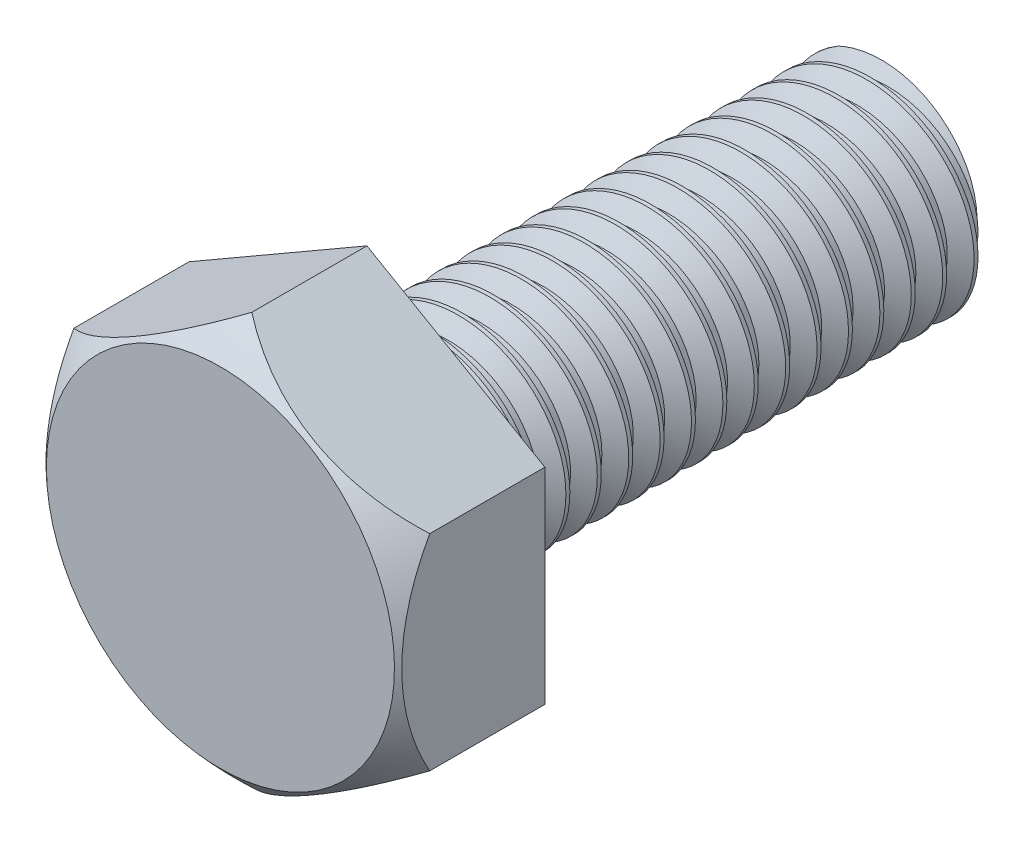
from build123d import *

# Parameters (mm, degrees)
SKETCH1_R           = 5
BOSS_EXTRUDE1_DEPTH = 25
BOSS_EXTRUDE2_DEPTH = 7
THREAD1_PITCH       = 1.5


with BuildPart() as part:
    # Sketch1 → Boss-Extrude1 (new body)
    with BuildSketch(Plane.XY):
        Circle(SKETCH1_R)
    extrude(amount=BOSS_EXTRUDE1_DEPTH)

    # Sketch2 → Boss-Extrude2 (add)
    with BuildSketch(Plane.XY.offset(25)):
        Polygon((0, -9.814954576), (8.5, -4.907477288), (8.5, 4.907477288), (0, 9.814954576), (-8.5, 4.907477288), (-8.5, -4.907477288), align=None)
    extrude(amount=BOSS_EXTRUDE2_DEPTH)

    # Sketch3 → Cut-Revolve1 (revolve, cut)
    with BuildSketch(Plane(origin=(0, 0, 0), x_dir=(0, 0, -1), z_dir=(1, 0, 0)), mode=Mode.PRIVATE) as cut_revolve1_sk:
        with BuildLine():
            Line((-30.5, 9.814954576), (-32, 9.814954576))
            Line((-32, 9.814954576), (-32, 8.314954576))
            ThreePointArc((-32, 8.314954576), (-31.272116302, 9.087070878), (-30.5, 9.814954576))
        make_face()
    revolve(cut_revolve1_sk.sketch.rotate(Axis((0, 0, 32), (0, 0, 1)), 240.000013872), axis=Axis((0, 0, 32), (0, 0, 1)), mode=Mode.SUBTRACT)

    # Thread1: the profile of Thread Profile1 profile screwed along a right-hand helix of 16.666667 turns, 8 arcs to a turn; built about Z, then put on its axis
    thread1_z = Axis((0, 0, 0), (0, 0, 1))
    thread1_corners = [(5.0003, 0, -0.000173205), (5.0003, 0, 1.312673201), (4.188101187, 0, 0.843749998), (4.188101187, 0, 0.468749998)]
    with BuildLine(mode=Mode.PRIVATE) as thread1_profile:
        Line(thread1_corners[0], thread1_corners[1])
        Line(thread1_corners[1], thread1_corners[2])
        Line(thread1_corners[2], thread1_corners[3])
        Line(thread1_corners[3], thread1_corners[0])
    thread1_cap = Face(thread1_profile.wire())
    thread1_turn_angles = [0, 22.5, 45, 67.5, 90, 112.5, 135, 157.5, 180, 202.5, 225, 247.5, 270, 292.5, 315, 337.5, 360]
    thread1_turn_weights = [1, 0.9238795325112867, 1, 0.9238795325112867, 1, 0.9238795325112867, 1, 0.9238795325112867, 1, 0.9238795325112867, 1, 0.9238795325112867, 1, 0.9238795325112867, 1, 0.9238795325112867, 1]
    thread1_turn_rails = [Edge.make_bspline([Vector(p[0], p[1], 0).rotate(thread1_z, thread1_turn_angles[k]) / thread1_turn_weights[k] + Vector(0, 0, p[2] + THREAD1_PITCH * thread1_turn_angles[k] / 360) for k in range(17)], [0, 0, 0, 1, 1, 2, 2, 3, 3, 4, 4, 5, 5, 6, 6, 7, 7, 8, 8, 8], 2, thread1_turn_weights) for p in thread1_corners]
    thread1_turn_sides = [Face.make_surface_from_curves(thread1_turn_rails[p[0]], thread1_turn_rails[p[1]]) for p in [(0, 1), (1, 2), (2, 3), (3, 0)]]
    thread1_last_angles = [5760, 5782.5, 5805, 5827.5, 5850, 5872.5, 5895, 5917.5, 5940, 5962.5, 5985, 5992.5, 6000]
    thread1_last_weights = [1, 0.9238795325112867, 1, 0.9238795325112867, 1, 0.9238795325112867, 1, 0.9238795325112867, 1, 0.9238795325112867, 1, 0.9914448613738115, 1]
    thread1_last_rails = [Edge.make_bspline([Vector(p[0], p[1], 0).rotate(thread1_z, thread1_last_angles[k]) / thread1_last_weights[k] + Vector(0, 0, p[2] + THREAD1_PITCH * thread1_last_angles[k] / 360) for k in range(13)], [0, 0, 0, 1, 1, 2, 2, 3, 3, 4, 4, 5, 5, 6, 6, 6], 2, thread1_last_weights) for p in thread1_corners]
    thread1_last_sides = [Face.make_surface_from_curves(thread1_last_rails[p[0]], thread1_last_rails[p[1]]) for p in [(0, 1), (1, 2), (2, 3), (3, 0)]]
    thread1 = Plane(origin=(0, 0, -2), x_dir=(1, 0, 0), z_dir=(0, 0, 1)) * Solid(Shell([*[p.moved(Location((0, 0, THREAD1_PITCH * i))) for i in range(16) for p in thread1_turn_sides], *thread1_last_sides, thread1_cap, thread1_cap.rotate(thread1_z, 6000).moved(Location((0, 0, THREAD1_PITCH * 6000 / 360)))]))
    add(thread1, mode=Mode.SUBTRACT)


solid = part.part
